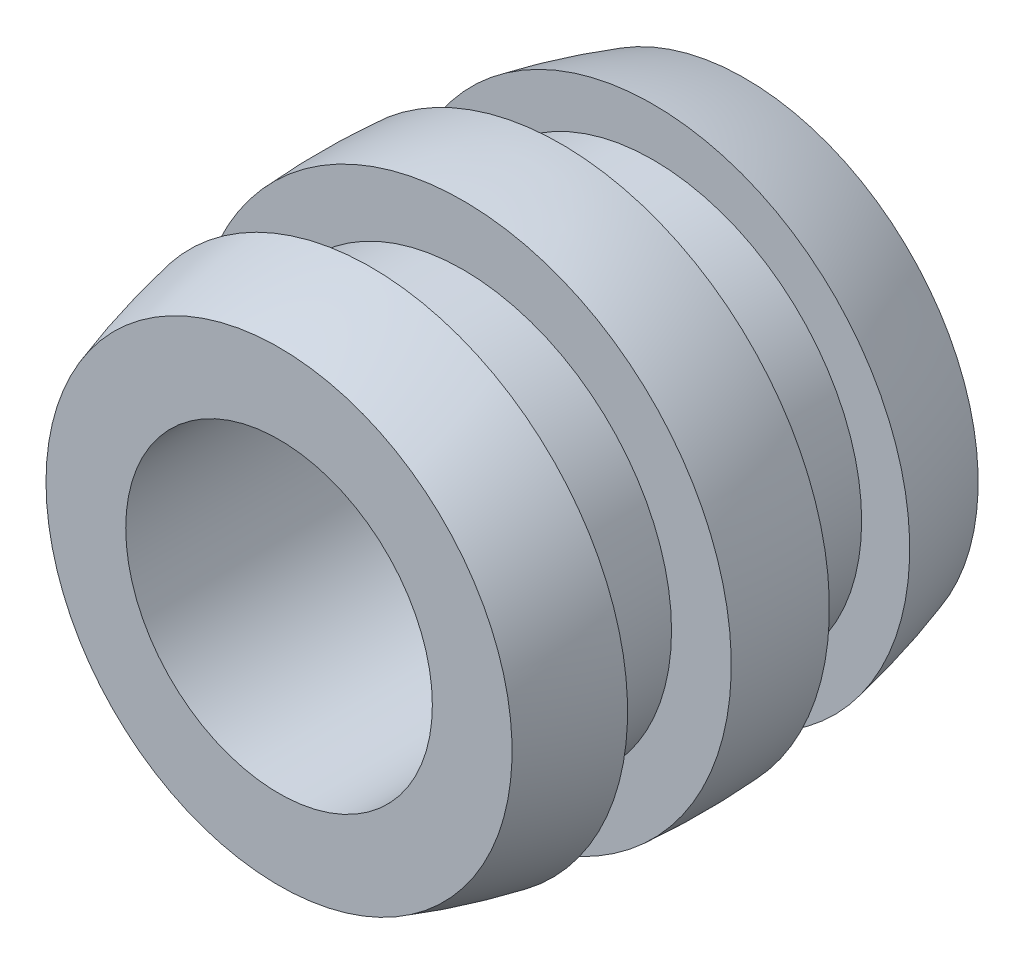
from build123d import *

# Parameters (mm, degrees)
CUT_EXTRUDE1_DEPTH      = 24.149212362
CUT_EXTRUDE1_DEPTH_BACK = 24.149212362
SKETCH3_R               = 7.9375


with BuildPart() as part:
    # Sketch2 → Revolve1 (revolve)
    with BuildSketch(Plane(origin=(0, 0, 0), x_dir=(0, 0, -1), z_dir=(1, 0, 0))):
        with BuildLine():
            Line((12.065, 0), (-12.065, 0))
            Line((-12.065, 0), (-12.065, 12.065))
            ThreePointArc((-12.065, 12.065), (-9.702882831, 12.74884018), (-7.3025, 13.283065955))
            Line((-7.3025, 13.283065955), (-7.3025, 10.795))
            Line((-7.3025, 10.795), (-2.54, 10.795))
            Line((-2.54, 10.795), (-2.54, 13.887534788))
            ThreePointArc((-2.54, 13.887534788), (0, 13.97), (2.54, 13.887534788))
            Line((2.54, 13.887534788), (2.54, 10.795))
            Line((2.54, 10.795), (7.3025, 10.795))
            Line((7.3025, 10.795), (7.3025, 13.283065955))
            ThreePointArc((7.3025, 13.283065955), (9.702882831, 12.74884018), (12.065, 12.065))
            Line((12.065, 12.065), (12.065, 0))
        make_face()
    revolve(axis=Axis((0, 0, -12.065), (0, 0, 1)))

    # Sketch3 → Cut-Extrude1 (cut, two sides: drawn at the far end of the back side and taken through both)
    with BuildSketch(Plane.XY.offset(-CUT_EXTRUDE1_DEPTH_BACK)):
        Circle(SKETCH3_R)
    extrude(amount=CUT_EXTRUDE1_DEPTH + CUT_EXTRUDE1_DEPTH_BACK, mode=Mode.SUBTRACT)


solid = part.part
